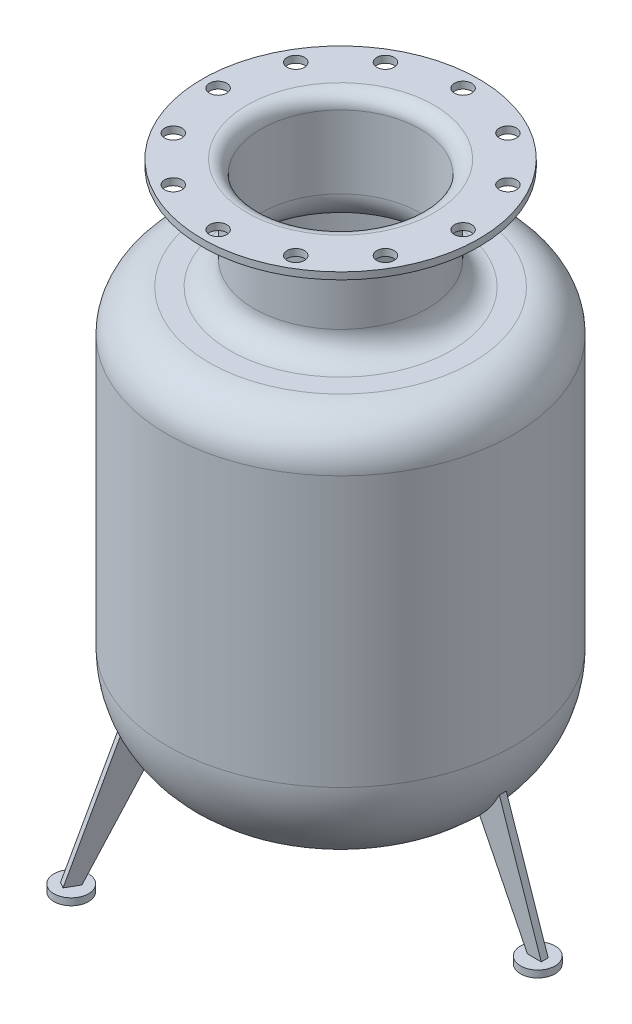
from build123d import *

# Parameters (mm, degrees)
HOLE2_START           = 749
HOLE2_OUTLINE_R       = 12.5
HOLE2_DEPTH           = 12
CIRPATTERN1_COUNT     = 12
SKETCH20_R            = 25
BOSS_EXTRUDE2_DEPTH   = 5
BOSS_EXTRUDE2_2_DEPTH = 5
BOSS_EXTRUDE2_3_DEPTH = 5
RIB1_START            = -5
RIB1_DEPTH            = 10
CIRPATTERN3_COUNT     = 3


with BuildPart() as part:
    # Sketch1 → Revolve1 (revolve)
    with BuildSketch(Plane.XY):
        with BuildLine():
            Line((190, 600), (160, 600))
            ThreePointArc((160, 600), (135.251262658, 610.251262658), (125, 635))
            Line((125, 635), (125, 740))
            ThreePointArc((125, 740), (127.928932188, 747.071067812), (135, 750))
            Line((135, 750), (200, 750))
            Line((200, 750), (200, 760))
            Line((200, 760), (135, 760))
            ThreePointArc((135, 760), (120.857864376, 754.142135624), (115, 740))
            Line((115, 740), (115, 635))
            ThreePointArc((115, 635), (128.180194847, 603.180194847), (160, 590))
            Line((160, 590), (190, 590))
            ThreePointArc((190, 590), (225.355339059, 575.355339059), (240, 540))
            Line((240, 540), (240, 150))
            ThreePointArc((240, 150), (198.994949366, 51.005050634), (100, 10))
            Line((100, 10), (0, 10))
            Line((0, 10), (0, 0))
            Line((0, 0), (100, 0))
            ThreePointArc((100, 0), (206.066017178, 43.933982822), (250, 150))
            Line((250, 150), (250, 540))
            ThreePointArc((250, 540), (232.426406871, 582.426406871), (190, 600))
        make_face()
    revolve(axis=Axis((0, -7153.429213209, 0), (0, 1, 0)))

    # Hole2: read off the stored shape, not the designer's step
    # Hole2 outline → Hole2 (cut)
    with BuildSketch(Plane(origin=(0, 0, 0), x_dir=(1, 0, 0), z_dir=(0, 1, 0)).offset(HOLE2_START)):
        with Locations((177.018309411, 0)):
            Circle(HOLE2_OUTLINE_R)
    hole2 = extrude(amount=HOLE2_DEPTH, mode=Mode.SUBTRACT)

    # CirPattern1: Hole2 ×12 about axis
    cirpattern1_axis = Axis((0, 0, 0), (0, 1, 0))
    for i in range(1, CIRPATTERN1_COUNT):
        add(hole2.rotate(cirpattern1_axis, i * 360 / CIRPATTERN1_COUNT), mode=Mode.SUBTRACT)


with BuildPart() as body_2:
    # Sketch20 → Boss-Extrude2 (new, symmetric)
    with BuildSketch(Plane(origin=(0, -100, 0), x_dir=(1, 0, 0), z_dir=(0, 1, 0))):
        with Locations(Location((285, 0, 0), (0, 0, 270))):
            Circle(SKETCH20_R)
    extrude(amount=BOSS_EXTRUDE2_DEPTH, both=True)


with BuildPart() as body_3:
    # Sketch20 → Boss-Extrude2 2 (new, symmetric)
    with BuildSketch(Plane(origin=(0, -100, 0), x_dir=(1, 0, 0), z_dir=(0, 1, 0))):
        with Locations(Location((-142.5, -246.817240079, 0), (0, 0, 270))):
            Circle(SKETCH20_R)
    extrude(amount=BOSS_EXTRUDE2_2_DEPTH, both=True)


with BuildPart() as body_4:
    # Sketch20 → Boss-Extrude2 3 (new, symmetric)
    with BuildSketch(Plane(origin=(0, -100, 0), x_dir=(1, 0, 0), z_dir=(0, 1, 0))):
        with Locations(Location((-142.5, 246.817240079, 0), (0, 0, 270))):
            Circle(SKETCH20_R)
    extrude(amount=BOSS_EXTRUDE2_3_DEPTH, both=True)


with BuildPart() as rib1_tool:
    # Rib1: read off the stored shape, not the designer's step
    # Rib1 outline → Rib1 (new body)
    with BuildSketch(Plane.XY.offset(RIB1_START)):
        with BuildLine():
            Line((275, -95), (295, -95))
            Line((295, -95), (234.432309918, 83.564942964))
            add(Edge.make_bspline(
                [(234.432309918, 83.564942964), (233.635837637, 81.952999316), (232.810377658, 80.355378627), (230.955273179, 76.917967215), (229.914966635, 75.083930594), (227.757873049, 71.461184139), (226.641079407, 69.672478234), (224.333085486, 66.143748071), (223.14188566, 64.403723517), (220.687184879, 60.975427111), (219.423683484, 59.287155574), (216.82664122, 55.965386271), (215.493100747, 54.331888196), (212.758071824, 51.122236955), (211.356569806, 49.54609535), (208.655424722, 46.63439248), (207.362935445, 45.292194729), (206.045896525, 43.97453513)],
                knots=[1081.318928005, 1081.318928005, 1081.318928005, 1081.318928005, 1086.712467068, 1086.712467068, 1093.036203669, 1093.036203669, 1099.360486685, 1099.360486685, 1105.684731161, 1105.684731161, 1112.009014098, 1112.009014098, 1118.333261393, 1118.333261393, 1124.658776435, 1124.658776435, 1130.247402131, 1130.247402131, 1130.247402131, 1130.247402131], degree=3))
            Line((206.045896525, 43.97453513), (275, -95))
        make_face()
    rib1 = extrude(amount=RIB1_DEPTH)


with BuildPart() as part_1:
    add(part.part)


with BuildPart() as part_2:
    # Rib1: joined with rib1_tool
    add(part_1.part.fuse(rib1_tool.part, tol=0.00001))

    # CirPattern3: Rib1 ×3 about axis
    cirpattern3_axis = Axis((0, 0, 0), (0, 1, 0))
    for i in range(1, CIRPATTERN3_COUNT):
        add(rib1.rotate(cirpattern3_axis, i * 360 / CIRPATTERN3_COUNT))


solid = Compound([body_2.part, body_3.part, body_4.part, part_2.part])
